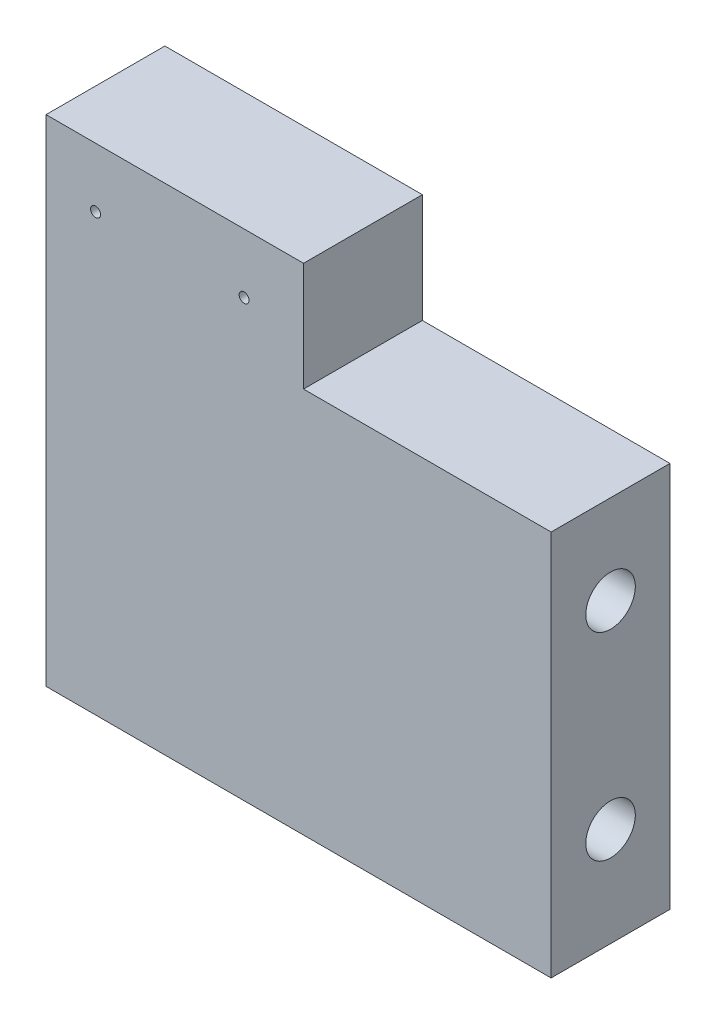
from build123d import *

# Parameters (mm, degrees)
SKETCH1_W           = 51
SKETCH1_H           = 50
BOSS_EXTRUDE1_DEPTH = 12
CUT_EXTRUDE1_REACH  = 74.422
SKETCH2_R           = 2.5
SKETCH3_R           = 5
CUT_EXTRUDE2_DEPTH  = 1.5
CUT_EXTRUDE3_REACH  = 74.422
SKETCH4_R           = 0.5
SKETCH4_W           = 25
SKETCH4_H           = 11


with BuildPart() as part:
    # Sketch1 → Boss-Extrude1 (new body)
    with BuildSketch(Plane.XY):
        with Locations((25.5, 25)):
            Rectangle(SKETCH1_W, SKETCH1_H)
    extrude(amount=BOSS_EXTRUDE1_DEPTH)

    # Sketch2 → Cut-Extrude1 (cut, up to next)
    with BuildSketch(Plane.ZY, mode=Mode.PRIVATE) as cut_extrude1_sk1:
        with Locations((6, 30)):
            Circle(SKETCH2_R)
    cut_extrude1_tool1 = extrude(cut_extrude1_sk1.sketch, amount=-CUT_EXTRUDE1_REACH, mode=Mode.PRIVATE) & part.part
    # Sketch2 → Cut-Extrude1 (cut, up to next)
    with BuildSketch(Plane.ZY, mode=Mode.PRIVATE) as cut_extrude1_sk2:
        with Locations((6, 10)):
            Circle(SKETCH2_R)
    cut_extrude1_tool2 = extrude(cut_extrude1_sk2.sketch, amount=-CUT_EXTRUDE1_REACH, mode=Mode.PRIVATE) & part.part
    add(cut_extrude1_tool1.solids().sort_by_distance((0, 30, 6))[0], mode=Mode.SUBTRACT)
    add(cut_extrude1_tool2.solids().sort_by_distance((0, 10, 6))[0], mode=Mode.SUBTRACT)

    # Sketch3 → Cut-Extrude2 (cut)
    with BuildSketch(Plane.ZY):
        with Locations((6, 30)):
            Circle(SKETCH3_R)
        with Locations((6, 10)):
            Circle(SKETCH3_R)
    extrude(amount=-CUT_EXTRUDE2_DEPTH, mode=Mode.SUBTRACT)

    # Sketch4 → Cut-Extrude3 (cut, up to next)
    with BuildSketch(Plane.XY.offset(12), mode=Mode.PRIVATE) as cut_extrude3_sk1:
        with Locations((5, 44)):
            Circle(SKETCH4_R)
    cut_extrude3_tool1 = extrude(cut_extrude3_sk1.sketch, amount=-CUT_EXTRUDE3_REACH, mode=Mode.PRIVATE) & part.part
    # Sketch4 → Cut-Extrude3 (cut, up to next)
    with BuildSketch(Plane.XY.offset(12), mode=Mode.PRIVATE) as cut_extrude3_sk2:
        with Locations((20, 44)):
            Circle(SKETCH4_R)
    cut_extrude3_tool2 = extrude(cut_extrude3_sk2.sketch, amount=-CUT_EXTRUDE3_REACH, mode=Mode.PRIVATE) & part.part
    # Sketch4 → Cut-Extrude3 (cut, up to next)
    with BuildSketch(Plane.XY.offset(12), mode=Mode.PRIVATE) as cut_extrude3_sk3:
        with Locations((38.5, 44.5)):
            Rectangle(SKETCH4_W, SKETCH4_H)
    cut_extrude3_tool3 = extrude(cut_extrude3_sk3.sketch, amount=-CUT_EXTRUDE3_REACH, mode=Mode.PRIVATE) & part.part
    add(cut_extrude3_tool1.solids().sort_by_distance((5, 44, 12))[0], mode=Mode.SUBTRACT)
    add(cut_extrude3_tool2.solids().sort_by_distance((20, 44, 12))[0], mode=Mode.SUBTRACT)
    add(cut_extrude3_tool3.solids().sort_by_distance((38.5, 44.5, 12))[0], mode=Mode.SUBTRACT)


solid = part.part
